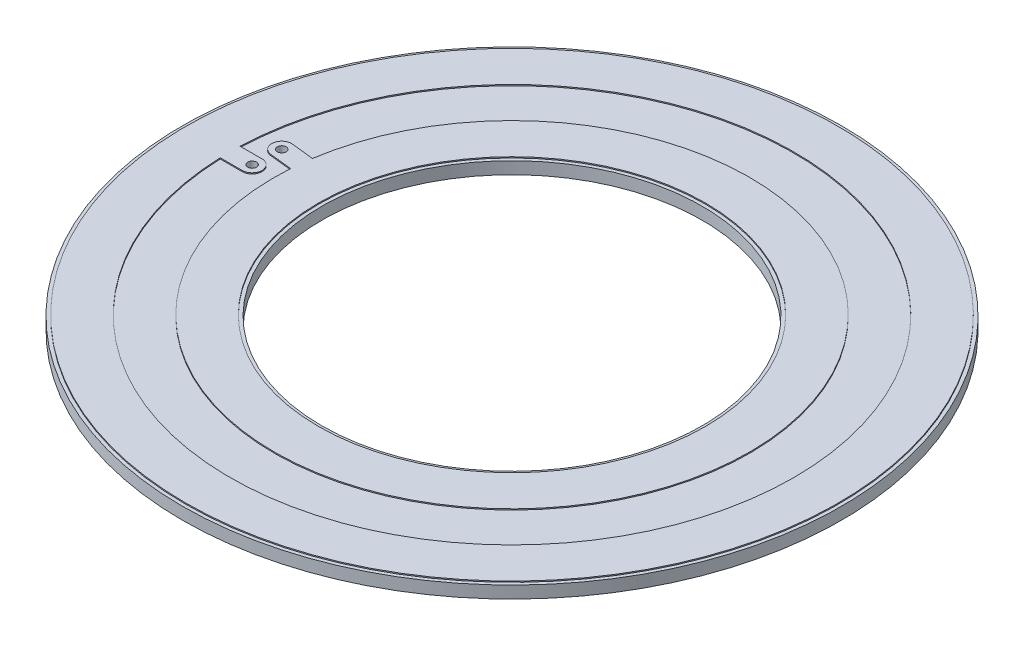
from build123d import *

# Parameters (mm, degrees)
SKETCH_1_R          = 29.8
SKETCH_1_R_2        = 17.2
EXTRUDE_1_DEPTH     = 1.1
SKETCH_2_R          = 29.5
SKETCH_2_R_2        = 25.5
SKETCH_2_R_3        = 21.5
SKETCH_2_R_4        = 17.5
EXTRUDE_2_DEPTH     = 0.1
SKETCH_4_R          = 0.4
CUT_EXTRUDE_1_DEPTH = 43.157917406
EXTRUDE_START       = 0.1
SKETCH_5_R          = 0.9
SKETCH_5_R_2        = 0.4
EXTRUDE_3_DEPTH     = 0.1
EXTRUDE_4_DEPTH     = 0.1


with BuildPart() as part:
    # Эскиз1 → Бобышка-Вытянуть1 (new body)
    with BuildSketch(Plane(origin=(0, 0, 0), x_dir=(1, 0, 0), z_dir=(0, 1, 0))):
        Circle(SKETCH_1_R)
        Circle(SKETCH_1_R_2, mode=Mode.SUBTRACT)
    extrude(amount=EXTRUDE_1_DEPTH)

    # Эскиз2 → Бобышка-Вытянуть2 (add)
    # profile 1 of 2: a face of its own
    with BuildSketch(Plane(origin=(0, 1.1, 0), x_dir=(1, 0, 0), z_dir=(0, 1, 0))):
        Circle(SKETCH_2_R)
        Circle(SKETCH_2_R_2, mode=Mode.SUBTRACT)
    # profile 2 of 2: a face of its own
    with BuildSketch(Plane(origin=(0, 1.1, 0), x_dir=(1, 0, 0), z_dir=(0, 1, 0))):
        Circle(SKETCH_2_R_3)
        Circle(SKETCH_2_R_4, mode=Mode.SUBTRACT)
    extrude(amount=EXTRUDE_2_DEPTH)

    # Эскиз4 → Вырез-Вытянуть1 (cut, through all)
    with BuildSketch(Plane(origin=(0, 1.1, 0), x_dir=(1, 0, 0), z_dir=(0, 1, 0))):
        with Locations((-23.5, 0)):
            Circle(SKETCH_4_R)
        with Locations((-23.362328651, 2.54)):
            Circle(SKETCH_4_R)
    extrude(amount=-CUT_EXTRUDE_1_DEPTH, mode=Mode.SUBTRACT)

    # Эскиз5 → Бобышка-Вытянуть3 (add)
    # profile 1 of 2: a face of its own
    with BuildSketch(Plane(origin=(0, 1.1, 0), x_dir=(1, 0, 0), z_dir=(0, 1, 0)).offset(EXTRUDE_START)):
        with Locations((-23.362328651, 2.54)):
            Circle(SKETCH_5_R)
        with Locations((-23.362328651, 2.54)):
            Circle(SKETCH_5_R_2, mode=Mode.SUBTRACT)
    # profile 2 of 2: a face of its own
    with BuildSketch(Plane(origin=(0, 1.1, 0), x_dir=(1, 0, 0), z_dir=(0, 1, 0)).offset(EXTRUDE_START)):
        with Locations((-23.5, 0)):
            Circle(SKETCH_5_R)
        with Locations((-23.5, 0)):
            Circle(SKETCH_5_R_2, mode=Mode.SUBTRACT)
    extrude(amount=-EXTRUDE_3_DEPTH)

    # Эскиз6 → Бобышка-Вытянуть4 (add)
    with BuildSketch(Plane(origin=(0, 1.1, 0), x_dir=(1, 0, 0), z_dir=(0, 1, 0))):
        Polygon((-23.5, -0.9), (-27.456522895, -0.9), (-27.456522895, 0.9), (-23.5, 0.9), (-24.110773747, 0), align=None)
        Polygon((-23.362328651, 1.64), (-20.018109834, 1.276409712), (-19.824696405, 3.05538141), (-23.168915221, 3.418971698), (-22.768010698, 2.47538454), align=None)
    extrude(amount=EXTRUDE_4_DEPTH)


solid = part.part
